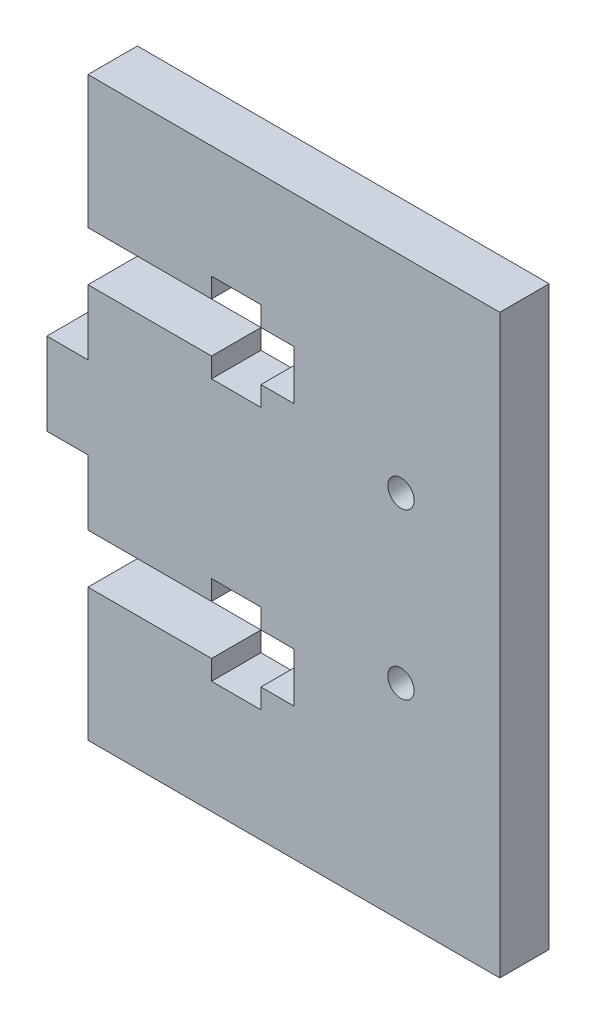
from build123d import *

# Parameters (mm, degrees)
SKETCH1_R           = 1.6
BOSS_EXTRUDE1_DEPTH = 6


with BuildPart() as part:
    # Sketch1 → Boss-Extrude1 (new body)
    with BuildSketch(Plane.XY):
        Polygon((-68, -35), (-118, -35), (-118, -18.9), (-103, -18.9), (-103, -21.3), (-97, -21.3), (-97, -18.9), (-93, -18.9), (-93, -12.9), (-97, -12.9), (-97, -10.5), (-103, -10.5), (-103, -12.9), (-118, -12.9), (-118, -5), (-123, -5), (-123, 5), (-118, 5), (-118, 12.9), (-103, 12.9), (-103, 10.5), (-97, 10.5), (-97, 12.9), (-93, 12.9), (-93, 18.9), (-97, 18.9), (-97, 21.3), (-103, 21.3), (-103, 18.9), (-118, 18.9), (-118, 35), (-68, 35), align=None)
        with Locations((-80, -10)):
            Circle(SKETCH1_R, mode=Mode.SUBTRACT)
        with Locations((-80, 10)):
            Circle(SKETCH1_R, mode=Mode.SUBTRACT)
    extrude(amount=BOSS_EXTRUDE1_DEPTH)


solid = part.part
